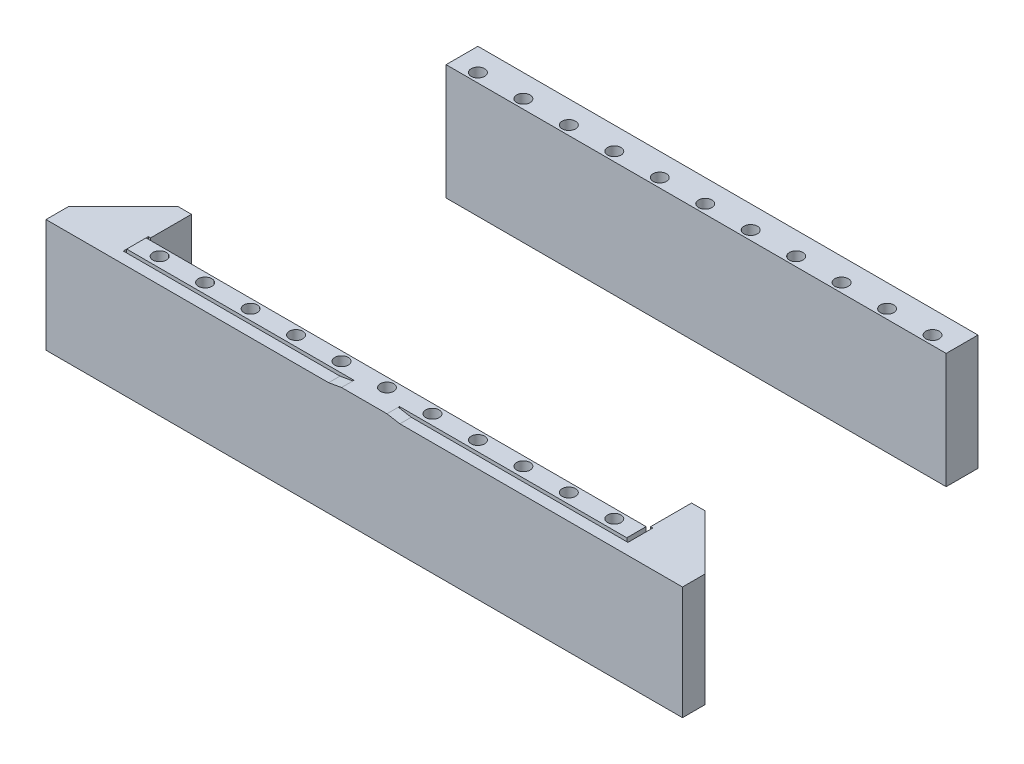
from build123d import *

# Parameters (mm, degrees)
SKETCH1_W           = 110
SKETCH1_H           = 80
BOSS_EXTRUDE1_DEPTH = 25.4
SKETCH2_W           = 66
SKETCH2_H           = 24
CUT_EXTRUDE1_DEPTH  = 120.771282034
SKETCH3_R           = 1.475
CUT_EXTRUDE2_DEPTH  = 73.595867651
LPATTERN1_COUNT     = 6
LPATTERN1_PITCH     = 10
LPATTERN1_COL_COUNT = 6
LPATTERN1_COL_PITCH = 10
BOSS_EXTRUDE2_DEPTH = 24.9
SKETCH11_W          = 10
SKETCH11_H          = 66
CUT_EXTRUDE7_DEPTH  = 75.431176264
SKETCH12_W          = 0.5
SKETCH12_H          = 9
BOSS_EXTRUDE5_DEPTH = 24.9
SKETCH5_W           = 50
SKETCH5_H           = 0.25
CUT_EXTRUDE3_DEPTH  = 75.894325553
SKETCH6_W           = 50
SKETCH6_H           = 2.5
CUT_EXTRUDE4_DEPTH  = 0.5
SKETCH7_W           = 12
SKETCH7_H           = 5
BOSS_EXTRUDE3_DEPTH = 24.9
BOSS_EXTRUDE4_DEPTH = 24.9
CHAMFER1_SIZE2      = 2.83564091
CHAMFER1_SIZE       = 0.5
SKETCH9_W           = 55
SKETCH9_H           = 80
CUT_EXTRUDE5_DEPTH  = 85.529048262
SKETCH10_W          = 90
SKETCH10_H          = 66
CUT_EXTRUDE6_DEPTH  = 85.118963379


with BuildPart() as part:
    # Sketch1 → Boss-Extrude1 (new body)
    with BuildSketch(Plane(origin=(0, 0, 0), x_dir=(1, 0, 0), z_dir=(0, 1, 0))):
        Rectangle(SKETCH1_W, SKETCH1_H)
    extrude(amount=BOSS_EXTRUDE1_DEPTH)

    # Sketch2 → Cut-Extrude1 (cut, through all)
    with BuildSketch(Plane(origin=(55, 0, 0), x_dir=(0, 0, -1), z_dir=(1, 0, 0))):
        with Locations((0, 13.4)):
            Rectangle(SKETCH2_W, SKETCH2_H)
    extrude(amount=-CUT_EXTRUDE1_DEPTH, mode=Mode.SUBTRACT)

    # Sketch3 → Cut-Extrude2 (cut, through all)
    with BuildSketch(Plane.XZ):
        with Locations(Location((0, 35, 0), (0, 0, 270))):
            Circle(SKETCH3_R)
        with Locations(Location((0, -35, 0), (0, 0, 270))):
            Circle(SKETCH3_R)
    cut_extrude2 = extrude(amount=-CUT_EXTRUDE2_DEPTH, mode=Mode.SUBTRACT)

    # LPattern1: Cut-Extrude2 ×6
    with Locations(*[(i * LPATTERN1_PITCH, 0, 0) for i in range(1, LPATTERN1_COUNT)]):
        add(cut_extrude2, mode=Mode.SUBTRACT)

    # LPattern1 col: Cut-Extrude2 ×6
    with Locations(*[(-i * LPATTERN1_COL_PITCH, 0, 0) for i in range(1, LPATTERN1_COL_COUNT)]):
        add(cut_extrude2, mode=Mode.SUBTRACT)

    # Sketch4 → Boss-Extrude2 (add)
    with BuildSketch(Plane(origin=(0, 0, 0), x_dir=(1, 0, 0), z_dir=(0, 1, 0))):
        Polygon((55, -40), (58, -40), (58, -37.5), (58, -23), (55.5, -23), (55.5, -37.5), (55, -37.5), align=None)
    extrude(amount=BOSS_EXTRUDE2_DEPTH)

    # Sketch11 → Cut-Extrude7 (cut, through all)
    with BuildSketch(Plane(origin=(0, 1.4, 0), x_dir=(1, 0, 0), z_dir=(0, 1, 0))):
        with Locations((50, 0)):
            Rectangle(SKETCH11_W, SKETCH11_H)
    extrude(amount=-CUT_EXTRUDE7_DEPTH, mode=Mode.SUBTRACT)

    # Sketch12 → Boss-Extrude5 (add)
    with BuildSketch(Plane(origin=(0, 0, 0), x_dir=(1, 0, 0), z_dir=(0, 1, 0))):
        with Locations((55.25, -27.5)):
            Rectangle(SKETCH12_W, SKETCH12_H)
    extrude(amount=BOSS_EXTRUDE5_DEPTH)

    # Sketch5 → Cut-Extrude3 (cut, through all)
    with BuildSketch(Plane(origin=(0, 25.4, 0), x_dir=(1, 0, 0), z_dir=(0, 1, 0))):
        with Locations((30, -37.375)):
            Rectangle(SKETCH5_W, SKETCH5_H)
    extrude(amount=-CUT_EXTRUDE3_DEPTH, mode=Mode.SUBTRACT)

    # Sketch6 → Cut-Extrude4 (cut)
    with BuildSketch(Plane(origin=(0, 25.4, 0), x_dir=(1, 0, 0), z_dir=(0, 1, 0))):
        with Locations((30, -38.75)):
            Rectangle(SKETCH6_W, SKETCH6_H)
    extrude(amount=-CUT_EXTRUDE4_DEPTH, mode=Mode.SUBTRACT)

    # Sketch7 → Boss-Extrude3 (add)
    with BuildSketch(Plane(origin=(0, 0, 0), x_dir=(1, 0, 0), z_dir=(0, 1, 0))):
        with Locations((64, -37.5)):
            Rectangle(SKETCH7_W, SKETCH7_H)
    extrude(amount=BOSS_EXTRUDE3_DEPTH)

    # Sketch8 → Boss-Extrude4 (add)
    with BuildSketch(Plane(origin=(0, 0, 0), x_dir=(1, 0, 0), z_dir=(0, 1, 0))):
        Polygon((58, -23), (70, -35), (58, -35), align=None)
    extrude(amount=BOSS_EXTRUDE4_DEPTH)

    # Chamfer1
    chamfer1_edges = [part.edges().sort_by_distance(p)[0] for p in [
        (5, 24.9, 38.75),
    ]]
    chamfer1_side = [part.faces().sort_by_distance(p)[0] for p in [
        (5, 24.91, 38.75),
    ]]
    chamfer(chamfer1_edges, length=CHAMFER1_SIZE - 0.0001, length2=CHAMFER1_SIZE2 - 0.0001, reference=chamfer1_side[0])  # a hair under: the kernel refuses the full size

    # Sketch9 → Cut-Extrude5 (cut, through all)
    with BuildSketch(Plane(origin=(0, 25.4, 0), x_dir=(1, 0, 0), z_dir=(0, 1, 0))):
        with Locations((-27.5, 0)):
            Rectangle(SKETCH9_W, SKETCH9_H)
    extrude(amount=-CUT_EXTRUDE5_DEPTH, mode=Mode.SUBTRACT)

    # Mirror1: part across plane


with BuildPart() as part_1:
    add(part.part)
    add(part.part.mirror(Plane(origin=(0, 0, -40), x_dir=(0, 0, 1), z_dir=(1, 0, 0))))

    # Sketch10 → Cut-Extrude6 (cut, through all)
    with BuildSketch(Plane(origin=(0, 1.4, 0), x_dir=(1, 0, 0), z_dir=(0, 1, 0))):
        Rectangle(SKETCH10_W, SKETCH10_H)
    extrude(amount=-CUT_EXTRUDE6_DEPTH, mode=Mode.SUBTRACT)


with BuildPart() as cut_extrude6_piece_1:
    # of the separate pieces the step leaves, piece 1, a body of its own (cut_extrude6_pieces)
    add(part_1.part.solids().sort_by_distance((5, 25.3999, 40))[0])


with BuildPart() as cut_extrude6_piece_2:
    # of the separate pieces the step leaves, piece 2, a body of its own (cut_extrude6_pieces)
    add(part_1.part.solids().sort_by_distance((55, 0, -33))[0])


solid = Compound([cut_extrude6_piece_1.part, cut_extrude6_piece_2.part])
